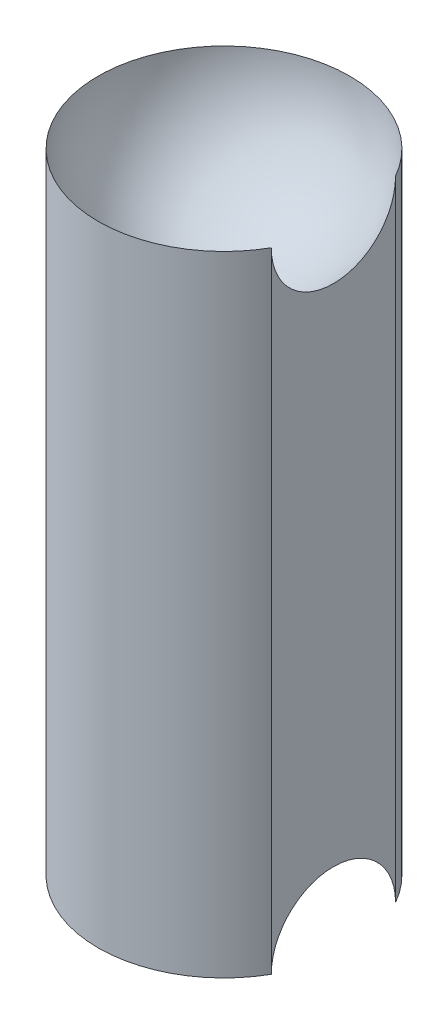
from build123d import *

# Parameters (mm, degrees)
SKETCH1_R               = 50
BOSS_EXTRUDE1_DEPTH     = 250
CUT_EXTRUDE1_DEPTH      = 260.807621135
CUT_EXTRUDE1_DEPTH_BACK = 260.807621135
SKETCH3_W               = 7.515334491
SKETCH3_H               = 262.678834124


with BuildPart() as part:
    # Sketch1 → Boss-Extrude1 (new body)
    with BuildSketch(Plane(origin=(0, 0, 0), x_dir=(1, 0, 0), z_dir=(0, 1, 0))):
        Circle(SKETCH1_R)
    extrude(amount=BOSS_EXTRUDE1_DEPTH)

    # Sketch2 → Cut-Revolve1 (revolve, cut)
    with BuildSketch(Plane.XY):
        with BuildLine():
            Line((0, 300), (0, 200))
            ThreePointArc((0, 200), (50, 250), (0, 300))
        make_face()
    cut_revolve1 = revolve(axis=Axis((0, 300, 0), (0, -1, 0)), mode=Mode.SUBTRACT)

    # Mirror2: Cut-Revolve1 across plane
    add(cut_revolve1.mirror(Plane.ZX.offset(125)), mode=Mode.SUBTRACT)

    # Sketch3 → Cut-Extrude1 (cut, two sides: drawn at the far end of the back side and taken through both)
    with BuildSketch(Plane.XY.offset(-CUT_EXTRUDE1_DEPTH_BACK)):
        with Locations((47.239245373, 124.642126929)):
            Rectangle(SKETCH3_W, SKETCH3_H)
    extrude(amount=CUT_EXTRUDE1_DEPTH + CUT_EXTRUDE1_DEPTH_BACK, mode=Mode.SUBTRACT)


solid = part.part
